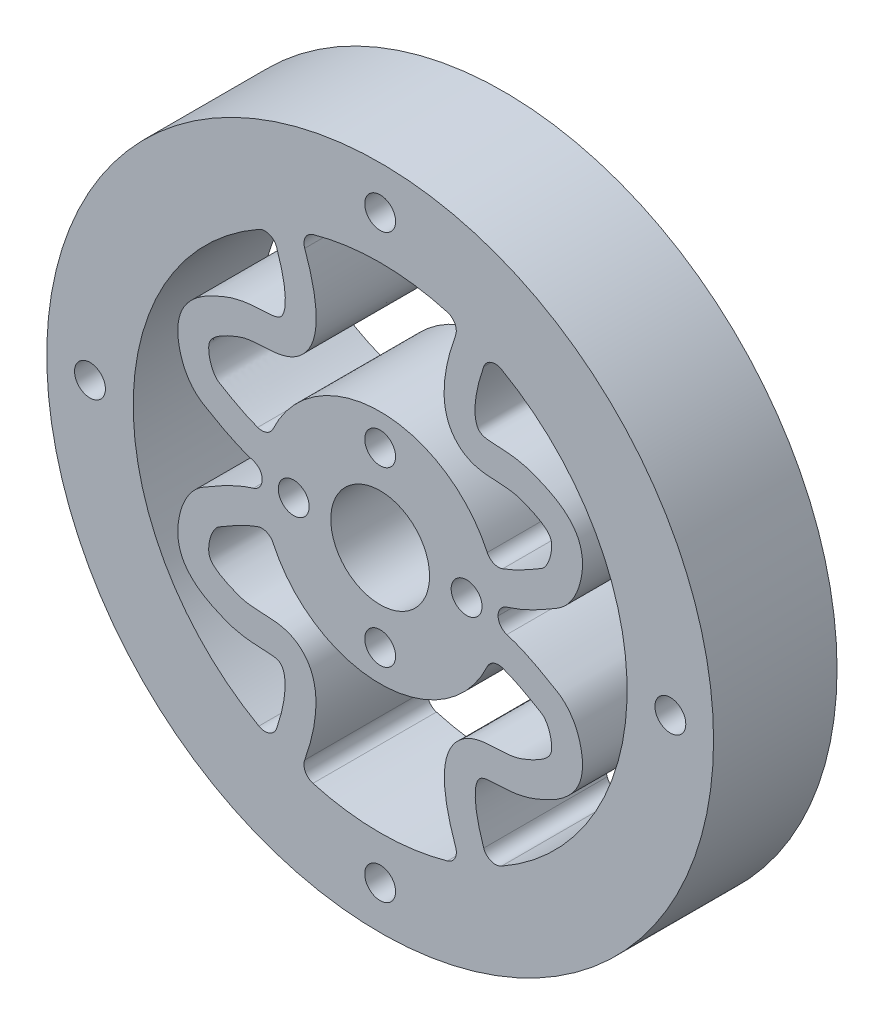
from build123d import *

# Parameters (mm, degrees)
BOSS_EXTRUDE1_OUTLINE_R   = 27
BOSS_EXTRUDE1_OUTLINE_R_2 = 1.25
BOSS_EXTRUDE1_OUTLINE_R_3 = 4
BOSS_EXTRUDE1_DEPTH       = 10
FILLET1_R                 = 1


# Read off the part's stored shape, not the designer's step: Boss-Extrude1
with BuildPart() as part:
    # Boss-Extrude1 outline → Boss-Extrude1 (new body)
    with BuildSketch(Plane.XY):
        Circle(BOSS_EXTRUDE1_OUTLINE_R)
        with Locations((0, -23.5)):
            Circle(BOSS_EXTRUDE1_OUTLINE_R_2, mode=Mode.SUBTRACT)
        with BuildLine():
            add(Edge.make_bspline(
                [(6.483801843, -18.919839155), (6.480612205, -18.912032776), (6.441503957, -18.816167051), (6.347612357, -18.58122213), (6.119029267, -17.980388927), (5.789810817, -17.013794353), (5.429669957, -15.668496809), (5.191806498, -14.230135337), (5.175407974, -12.761834066), (5.524401823, -11.283291588), (6.409718684, -10.166991751), (7.454125678, -9.625091073), (8.350033292, -9.42542645), (9.170309196, -9.376479516), (9.947678619, -9.350570154), (10.675240534, -9.288463207), (11.237211138, -9.169079776), (11.932036453, -8.89638821), (12.637697815, -8.576891164), (13.211834821, -8.233451201), (13.613150576, -7.882315625), (13.813065964, -7.569945647), (13.896838471, -7.281813359), (13.879539964, -6.641593544), (13.73039878, -6.059941379), (13.55175681, -5.653270156), (13.396702845, -5.396835282), (13.265283039, -5.238744867), (13.160626685, -5.14359219), (13.101918554, -5.098485448), (12.979648753, -5.022079201), (12.577995362, -4.7934595), (11.724742054, -4.291783433), (10.601060528, -3.730602471), (9.652508015, -3.377233049), (9.21951845, -3.260097231), (8.993066806, -3.214723866)],
                knots=[0.007762367, 0.007762367, 0.007762367, 0.007762367, 0.009702959, 0.03125, 0.0625, 0.125, 0.1875, 0.25, 0.3125, 0.375, 0.4375, 0.46875, 0.5, 0.53125, 0.5625, 0.59375, 0.625, 0.65625, 0.6875, 0.71875, 0.75, 0.78125, 0.8125, 0.84375, 0.875, 0.890625, 0.90625, 0.921875, 0.9296875, 0.9375, 0.9453125, 0.953125, 0.96875, 0.984375, 0.9921875, 1, 1, 1, 1], degree=3))
            ThreePointArc((6.483801843, -18.919839155), (0, -20), (-6.483801843, -18.919839155))
            add(Edge.make_bspline(
                [(-6.483801843, -18.919839155), (-6.480612205, -18.912032776), (-6.441503957, -18.816167051), (-6.347612357, -18.58122213), (-6.119029267, -17.980388927), (-5.789810817, -17.013794353), (-5.429669957, -15.668496809), (-5.191806498, -14.230135337), (-5.175407974, -12.761834066), (-5.524401823, -11.283291588), (-6.409718684, -10.166991751), (-7.454125678, -9.625091073), (-8.350033292, -9.42542645), (-9.170309196, -9.376479516), (-9.947678619, -9.350570154), (-10.675240534, -9.288463207), (-11.237211138, -9.169079776), (-11.932036453, -8.89638821), (-12.637697815, -8.576891164), (-13.211834821, -8.233451201), (-13.613150576, -7.882315625), (-13.813065964, -7.569945647), (-13.896838471, -7.281813359), (-13.879539964, -6.641593544), (-13.73039878, -6.059941379), (-13.55175681, -5.653270156), (-13.396702845, -5.396835282), (-13.265283039, -5.238744867), (-13.160626685, -5.14359219), (-13.101918554, -5.098485448), (-12.979648753, -5.022079201), (-12.577995362, -4.7934595), (-11.724742054, -4.291783433), (-10.601060528, -3.730602471), (-9.652508015, -3.377233049), (-9.21951845, -3.260097231), (-8.993066806, -3.214723866)],
                knots=[0.007762367, 0.007762367, 0.007762367, 0.007762367, 0.009702959, 0.03125, 0.0625, 0.125, 0.1875, 0.25, 0.3125, 0.375, 0.4375, 0.46875, 0.5, 0.53125, 0.5625, 0.59375, 0.625, 0.65625, 0.6875, 0.71875, 0.75, 0.78125, 0.8125, 0.84375, 0.875, 0.890625, 0.90625, 0.921875, 0.9296875, 0.9375, 0.9453125, 0.953125, 0.96875, 0.984375, 0.9921875, 1, 1, 1, 1], degree=3))
            ThreePointArc((-8.993066806, -3.214723866), (0, -9.550376962), (8.993066806, -3.214723866))
        make_face(mode=Mode.SUBTRACT)
        with Locations((0, -7)):
            Circle(BOSS_EXTRUDE1_OUTLINE_R_2, mode=Mode.SUBTRACT)
        with Locations((-23.5, 0)):
            Circle(BOSS_EXTRUDE1_OUTLINE_R_2, mode=Mode.SUBTRACT)
        with BuildLine():
            add(Edge.make_bspline(
                [(-8.793765965, -17.963008661), (-8.790561612, -17.955152681), (-8.757299555, -17.873459033), (-8.675456351, -17.668379774), (-8.473919568, -17.138762569), (-8.182262794, -16.281745106), (-7.874017475, -15.126473634), (-7.688580164, -13.981174059), (-7.68708969, -12.988779781), (-7.882450811, -12.340385911), (-8.105574911, -12.101711107), (-8.427286637, -11.936185887), (-9.255887466, -11.873584818), (-10.061993387, -11.846676872), (-10.980530297, -11.780784628), (-12.037855007, -11.548544014), (-12.901369588, -11.200056501), (-14.054290483, -10.681134366), (-15.231238441, -9.924658048), (-16.128927134, -8.661627788), (-16.433708137, -7.419671476), (-16.361750971, -6.266622794), (-16.068776901, -5.081044273), (-15.596575411, -4.134652828), (-15.106286502, -3.535992931), (-14.774613082, -3.227707308), (-14.488277389, -3.0127142), (-14.214236794, -2.847608081), (-13.840221024, -2.635292087), (-12.932474986, -2.101308455), (-11.383068607, -1.322241381), (-10.154677906, -0.901179774), (-9.522201544, -0.770857912), (-9.519265086, -0.770254719)],
                knots=[0.008782184, 0.008782184, 0.008782184, 0.008782184, 0.01097773, 0.03125, 0.0625, 0.125, 0.1875, 0.25, 0.3125, 0.375, 0.4375, 0.5, 0.53125, 0.5625, 0.59375, 0.625, 0.65625, 0.6875, 0.75, 0.78125, 0.8125, 0.84375, 0.875, 0.90625, 0.921875, 0.9296875, 0.9375, 0.9453125, 0.953125, 0.96875, 0.984375, 0.999644738, 0.99971579, 0.99971579, 0.99971579, 0.99971579], degree=3))
            ThreePointArc((-8.793765965, -17.963008661), (-20, 0), (-8.793765965, 17.963008661))
            add(Edge.make_bspline(
                [(-8.793765965, 17.963008661), (-8.792390185, 17.959667216), (-8.751090896, 17.859289875), (-8.659149113, 17.630898508), (-8.442492857, 17.062585707), (-8.150200233, 16.204626452), (-7.847022713, 15.063271185), (-7.669490667, 13.941546746), (-7.675936835, 12.977642097), (-7.87172167, 12.356105989), (-8.096556435, 12.116445797), (-8.437268015, 11.945555936), (-9.265970028, 11.877370514), (-10.069148732, 11.843745886), (-10.982990761, 11.771223658), (-12.032129114, 11.536768835), (-12.892956915, 11.190784402), (-14.04568893, 10.675396667), (-15.225024196, 9.924481098), (-16.127345354, 8.662487813), (-16.433024316, 7.418347937), (-16.360717665, 6.265882856), (-16.068019021, 5.080296428), (-15.595762735, 4.133827462), (-15.105222866, 3.535092161), (-14.773373049, 3.226801646), (-14.486865721, 3.011813821), (-14.212855625, 2.846812002), (-13.839019105, 2.634637657), (-12.931736587, 2.100862468), (-11.383019871, 1.3220545), (-10.15471139, 0.901122285), (-9.522198334, 0.770856958), (-9.519265086, 0.770254719)],
                knots=[0.003708072, 0.003708072, 0.003708072, 0.003708072, 0.00463509, 0.03125, 0.0625, 0.125, 0.1875, 0.25, 0.3125, 0.375, 0.4375, 0.5, 0.53125, 0.5625, 0.59375, 0.625, 0.65625, 0.6875, 0.75, 0.78125, 0.8125, 0.84375, 0.875, 0.90625, 0.921875, 0.9296875, 0.9375, 0.9453125, 0.953125, 0.96875, 0.984375, 0.999645143, 0.999716115, 0.999716115, 0.999716115, 0.999716115], degree=3))
            ThreePointArc((-9.519265086, 0.770254719), (-9.550376962, 0), (-9.519265086, -0.770254719))
        make_face(mode=Mode.SUBTRACT)
        with Locations((-7, 0)):
            Circle(BOSS_EXTRUDE1_OUTLINE_R_2, mode=Mode.SUBTRACT)
        Circle(BOSS_EXTRUDE1_OUTLINE_R_3, mode=Mode.SUBTRACT)
        with Locations((7, 0)):
            Circle(BOSS_EXTRUDE1_OUTLINE_R_2, mode=Mode.SUBTRACT)
        with Locations((0, 7)):
            Circle(BOSS_EXTRUDE1_OUTLINE_R_2, mode=Mode.SUBTRACT)
        with BuildLine():
            add(Edge.make_bspline(
                [(-6.483801843, 18.919839155), (-6.482428599, 18.916506133), (-6.435464145, 18.802446138), (-6.331751534, 18.544967686), (-6.088032516, 17.905633276), (-5.757506339, 16.936431605), (-5.401217095, 15.600475059), (-5.170938786, 14.177815551), (-5.164642087, 12.726303988), (-5.529593155, 11.262265681), (-6.422218406, 10.16816807), (-7.45697845, 9.636564412), (-8.34365536, 9.435395123), (-9.159513397, 9.380214885), (-9.934554469, 9.347855416), (-10.662113343, 9.280670847), (-11.229957293, 9.157678589), (-11.928251207, 8.884298538), (-12.636049231, 8.566038906), (-13.211909719, 8.224307826), (-13.613520282, 7.875254277), (-13.812127691, 7.566169682), (-13.895424665, 7.281234026), (-13.878139336, 6.639916023), (-13.729050873, 6.058586057), (-13.550532405, 5.652168502), (-13.395576418, 5.39596311), (-13.264221021, 5.238013923), (-13.159545079, 5.142897705), (-13.100787625, 5.097777089), (-12.978253874, 5.021254727), (-12.576385364, 4.792575773), (-11.723550617, 4.29110232), (-10.60055857, 3.730267544), (-9.65244952, 3.377137573), (-9.219480083, 3.260062194), (-8.993066806, 3.214723866)],
                knots=[0.003301299, 0.003301299, 0.003301299, 0.003301299, 0.004126624, 0.03125, 0.0625, 0.125, 0.1875, 0.25, 0.3125, 0.375, 0.4375, 0.46875, 0.5, 0.53125, 0.5625, 0.59375, 0.625, 0.65625, 0.6875, 0.71875, 0.75, 0.78125, 0.8125, 0.84375, 0.875, 0.890625, 0.90625, 0.921875, 0.9296875, 0.9375, 0.9453125, 0.953125, 0.96875, 0.984375, 0.9921875, 1, 1, 1, 1], degree=3))
            ThreePointArc((-6.483801843, 18.919839155), (0, 20), (6.483801843, 18.919839155))
            add(Edge.make_bspline(
                [(6.483801843, 18.919839155), (6.427558814, 18.784051049), (6.324537132, 18.529168098), (6.073882061, 17.871349196), (5.745428657, 16.907087807), (5.392085426, 15.577928796), (5.165001465, 14.161924058), (5.162032487, 12.716063833), (5.531376946, 11.256563451), (6.425565101, 10.168329975), (7.457974124, 9.63919877), (8.342543019, 9.437703347), (9.157376636, 9.381112059), (9.931882007, 9.347282574), (10.659445482, 9.278940922), (11.228646085, 9.155126895), (11.927746574, 8.881616393), (12.636043239, 8.56367028), (13.212306684, 8.222358626), (13.613990776, 7.873804728), (13.812299546, 7.565496628), (13.895496378, 7.281312129), (13.878231204, 6.639848031), (13.729136155, 6.05855138), (13.550624612, 5.652134143), (13.39567622, 5.395932335), (13.264328523, 5.237983984), (13.159663821, 5.142870471), (13.10090948, 5.097749149), (12.978423161, 5.021248624), (12.576606002, 4.792594285), (11.723719853, 4.29112662), (10.600636073, 3.730284389), (9.652465038, 3.377144046), (9.219486979, 3.260065429), (8.993066806, 3.214723866)],
                knots=[2.7542e-05, 2.7542e-05, 2.7542e-05, 2.7542e-05, 0.03125, 0.0625, 0.125, 0.1875, 0.25, 0.3125, 0.375, 0.4375, 0.46875, 0.5, 0.53125, 0.5625, 0.59375, 0.625, 0.65625, 0.6875, 0.71875, 0.75, 0.78125, 0.8125, 0.84375, 0.875, 0.890625, 0.90625, 0.921875, 0.9296875, 0.9375, 0.9453125, 0.953125, 0.96875, 0.984375, 0.9921875, 1, 1, 1, 1], degree=3))
            ThreePointArc((8.993066806, 3.214723866), (0, 9.550376962), (-8.993066806, 3.214723866))
        make_face(mode=Mode.SUBTRACT)
        with BuildLine():
            add(Edge.make_bspline(
                [(8.793765964, 17.963008661), (8.743696315, 17.842124252), (8.652024593, 17.615315229), (8.428556729, 17.028880945), (8.138535996, 16.176583266), (7.838516203, 15.04335892), (7.664046059, 13.930304494), (7.672917525, 12.974810129), (7.868875384, 12.359933936), (8.09461171, 12.119578752), (8.439880369, 11.947457623), (9.268619588, 11.87798157), (10.071117318, 11.842821716), (10.983851503, 11.768791985), (12.03106163, 11.533866993), (12.89126609, 11.188486281), (14.043949333, 10.673948938), (15.223811446, 9.924371515), (16.12718592, 8.662713201), (16.433111818, 7.418171723), (16.360730957, 6.265768417), (16.068051422, 5.080203116), (15.595819703, 4.133782126), (15.105329849, 3.535077718), (14.773513769, 3.226799381), (14.487046012, 3.011821514), (14.213025533, 2.846799467), (13.839137176, 2.634594588), (12.931786752, 2.100819871), (11.38089886, 1.320987455), (10.135468469, 0.896850952), (9.519264913, 0.770256852)],
                knots=[3.1817e-05, 3.1817e-05, 3.1817e-05, 3.1817e-05, 0.03125, 0.0625, 0.125, 0.1875, 0.25, 0.3125, 0.375, 0.4375, 0.5, 0.53125, 0.5625, 0.59375, 0.625, 0.65625, 0.6875, 0.75, 0.78125, 0.8125, 0.84375, 0.875, 0.90625, 0.921875, 0.9296875, 0.9375, 0.9453125, 0.953125, 0.96875, 0.984375, 0.99970761, 0.99970761, 0.99970761, 0.99970761], degree=3))
            ThreePointArc((8.793765964, 17.963008661), (20, 0), (8.793765965, -17.963008661))
            add(Edge.make_bspline(
                [(8.793765965, -17.963008661), (8.790561612, -17.955152681), (8.757299555, -17.873459033), (8.675456351, -17.668379774), (8.473919568, -17.138762569), (8.182262794, -16.281745106), (7.874017475, -15.126473634), (7.688580163, -13.981174059), (7.68708969, -12.988779781), (7.882450811, -12.340385911), (8.105574911, -12.101711107), (8.427286637, -11.936185887), (9.255887466, -11.873584818), (10.061993387, -11.846676872), (10.980530297, -11.780784628), (12.037855007, -11.548544014), (12.901369588, -11.200056501), (14.054290483, -10.681134366), (15.231238441, -9.924658048), (16.128927134, -8.661627788), (16.433708137, -7.419671476), (16.361750971, -6.266622794), (16.068776901, -5.081044273), (15.596575411, -4.134652828), (15.106286502, -3.535992931), (14.774613082, -3.227707308), (14.488277389, -3.0127142), (14.214236794, -2.847608081), (13.840221024, -2.635292087), (12.932474986, -2.101308455), (11.383068607, -1.322241381), (10.154677906, -0.901179774), (9.522201544, -0.770857912), (9.519265086, -0.770254719)],
                knots=[0.008782184, 0.008782184, 0.008782184, 0.008782184, 0.01097773, 0.03125, 0.0625, 0.125, 0.1875, 0.25, 0.3125, 0.375, 0.4375, 0.5, 0.53125, 0.5625, 0.59375, 0.625, 0.65625, 0.6875, 0.75, 0.78125, 0.8125, 0.84375, 0.875, 0.90625, 0.921875, 0.9296875, 0.9375, 0.9453125, 0.953125, 0.96875, 0.984375, 0.999644738, 0.99971579, 0.99971579, 0.99971579, 0.99971579], degree=3))
            ThreePointArc((9.519265086, -0.770254719), (9.550376962, 1.07e-06), (9.519264913, 0.770256852))
        make_face(mode=Mode.SUBTRACT)
        with Locations((23.5, 0)):
            Circle(BOSS_EXTRUDE1_OUTLINE_R_2, mode=Mode.SUBTRACT)
        with Locations((0, 23.5)):
            Circle(BOSS_EXTRUDE1_OUTLINE_R_2, mode=Mode.SUBTRACT)
    extrude(amount=BOSS_EXTRUDE1_DEPTH)

    # Fillet1
    fillet1_edges = [part.edges().sort_by_distance(p)[0] for p in [
        (8.993066806, 3.214723866, 5),
        (-8.993066806, 3.214723866, 5),
        (9.519264913, 0.770256852, 5),
        (9.519265086, -0.770254719, 5),
        (8.993066806, -3.214723866, 5),
        (-8.993066806, -3.214723866, 5),
        (-9.519265086, 0.770254719, 5),
        (-9.519265086, -0.770254719, 5),
        (6.483801843, -18.919839155, 5),
        (-8.793765965, -17.963008661, 5),
        (8.793765965, -17.963008661, 5),
        (6.483801843, 18.919839155, 5),
        (8.793765964, 17.963008661, 5),
        (-6.483801843, -18.919839155, 5),
        (-6.483801843, 18.919839155, 5),
        (-8.793765965, 17.963008661, 5),
    ]]
    fillet(fillet1_edges, radius=FILLET1_R)


solid = part.part
